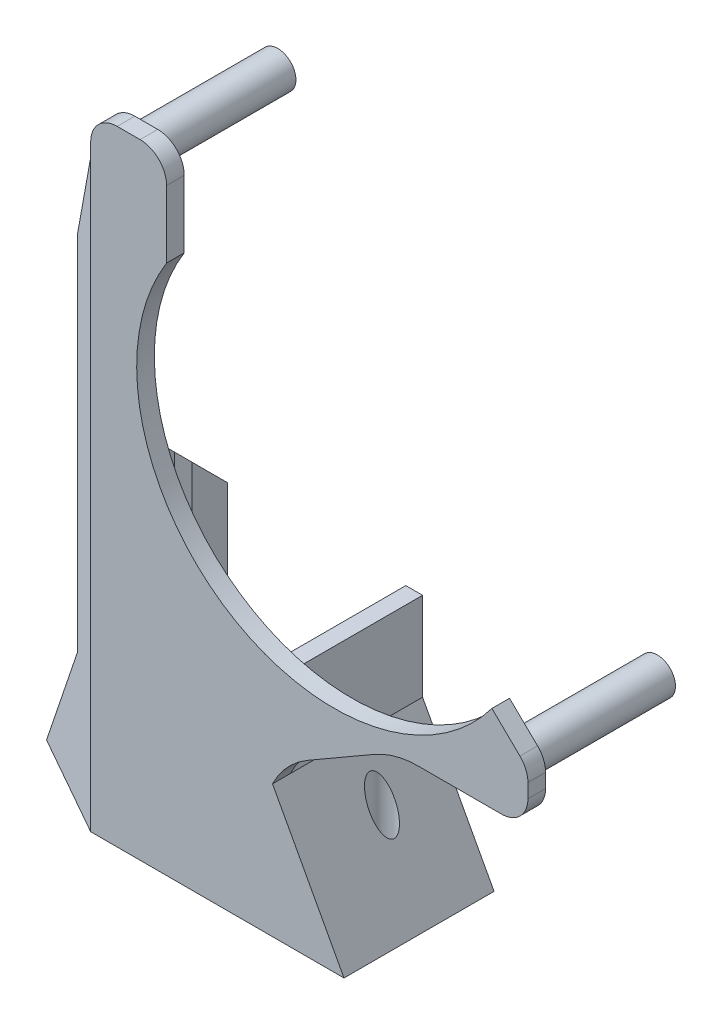
from build123d import *

# Parameters (mm, degrees)
SKETCH1_W               = 24
SKETCH1_H               = 25
BOSS_EXTRUDE1_DEPTH     = 17
SKETCH2_W               = 20.2
SKETCH2_H               = 15
CUT_EXTRUDE1_DEPTH      = 33.526911935
BOSS_EXTRUDE2_DEPTH     = 17
SKETCH5_R               = 1.4
CUT_EXTRUDE5_DEPTH      = 37.304407446
BOSS_EXTRUDE3_DEPTH     = 2
CUT_EXTRUDE4_DEPTH      = 74.16252394
CUT_EXTRUDE4_DEPTH_BACK = 74.16252394
SKETCH7_R               = 2.05
BOSS_EXTRUDE4_DEPTH     = 16
CHAMFER1_SIZE           = 1
CHAMFER2_SIZE           = 8
CHAMFER2_SIZE2          = 13.856406461
FILLET1_R               = 10
SKETCH8_W               = 1.9
SKETCH8_H               = 25
BOSS_EXTRUDE5_DEPTH     = 5
CHAMFER5_SIZE           = 5
CHAMFER6_SIZE           = 10
FILLET5_R               = 3
SKETCH9_W               = 5
SKETCH9_H               = 20.312892552
CUT_EXTRUDE6_DEPTH      = 1
CHAMFER7_SIZE           = 1


# Some blends are built 0.0001 mm under size
with BuildPart() as part:
    # Sketch1 → Boss-Extrude1 (new body)
    with BuildSketch(Plane.XY):
        Rectangle(SKETCH1_W, SKETCH1_H)
    extrude(amount=BOSS_EXTRUDE1_DEPTH)

    # Sketch2 → Cut-Extrude1 (cut, through all)
    with BuildSketch(Plane(origin=(0, 12.5, 0), x_dir=(1, 0, 0), z_dir=(0, 1, 0))):
        with Locations((0, -7.5)):
            Rectangle(SKETCH2_W, SKETCH2_H)
    extrude(amount=-CUT_EXTRUDE1_DEPTH, mode=Mode.SUBTRACT)

    # Sketch3 → Boss-Extrude2 (add)
    with BuildSketch(Plane.XY.offset(17)):
        Polygon((-12, -12.5), (-20.1, -12.5), (-12, 2.5), align=None)
        Polygon((12, -12.5), (20.1, -12.5), (12, 2.5), align=None)
    extrude(amount=-BOSS_EXTRUDE2_DEPTH)

    # Sketch5 → Cut-Extrude5 (cut, through all)
    with BuildSketch(Plane.XZ.offset(12.5)):
        with Locations(Location((-14.9, 7.5, 0), (0, 0, 270))):
            Circle(SKETCH5_R)
        with Locations(Location((14.9, 7.5, 0), (0, 0, 270))):
            Circle(SKETCH5_R)
    extrude(amount=-CUT_EXTRUDE5_DEPTH, mode=Mode.SUBTRACT)

    # Sketch6 → Boss-Extrude3 (add)
    with BuildSketch(Plane.XY.offset(17)):
        with BuildLine():
            Line((12, 12.5), (40.935171065, 12.5))
            Line((40.935171065, 12.5), (40.935171065, 18.357473763))
            Line((40.935171065, 18.357473763), (36.855912663, 22.32654969))
            ThreePointArc((36.855912663, 22.32654969), (6.329925709, 17.315872383), (0, 47.595813056))
            Line((0, 47.595813056), (0, 58.207101621))
            Line((0, 58.207101621), (-8.6, 58.207101621))
            Line((-8.6, 58.207101621), (-8.6, 53.667646312))
            Line((-8.6, 53.667646312), (-12, 43.559109862))
            Line((-12, 43.559109862), (-12, 12.5))
            Line((-12, 12.5), (12, 12.5))
        make_face()
    extrude(amount=-BOSS_EXTRUDE3_DEPTH)

    # Sketch4 → Cut-Extrude4 (cut, two sides: drawn at the far end of the back side and taken through both)
    with BuildSketch(Plane(origin=(0, 0, 0), x_dir=(1, 0, 0), z_dir=(0, 1, 0)).offset(-CUT_EXTRUDE4_DEPTH_BACK)):
        Polygon((-8.6, -17), (-20.1, -17), (-20.1, -10.5), align=None)
    extrude(amount=CUT_EXTRUDE4_DEPTH + CUT_EXTRUDE4_DEPTH_BACK, mode=Mode.SUBTRACT)

    # Sketch7 → Boss-Extrude4 (add)
    with BuildSketch(Plane(origin=(0, 0, 15), x_dir=(-1, 0, 0), z_dir=(0, 0, -1))):
        with Locations(Location((-37.6, 16.9, 0), (0, 0, 180))):
            Circle(SKETCH7_R)
        with Locations(Location((5.4, 54.9, 0), (0, 0, 180))):
            Circle(SKETCH7_R)
    extrude(amount=BOSS_EXTRUDE4_DEPTH)

    # Chamfer1
    chamfer1_edges = [part.edges().sort_by_distance(p)[0] for p in [
        (-14.9, -12.5, 8.9),
        (14.9, -12.5, 8.9),
    ]]
    chamfer(chamfer1_edges, length=CHAMFER1_SIZE)

    # Chamfer2
    chamfer2_edges = [part.edges().sort_by_distance(p)[0] for p in [
        (12, 12.5, 16),
    ]]
    chamfer2_side = [part.faces().sort_by_distance(p)[0] for p in [
        (12, 7.5, 8.5),
    ]]
    chamfer(chamfer2_edges, length=CHAMFER2_SIZE, length2=CHAMFER2_SIZE2, reference=chamfer2_side[0])

    # Fillet1
    # the kernel refuses this fillet: 10 mm, written as the material it adds along each edge
    with BuildSketch(Plane(origin=(12, 4.5, 15), x_dir=(0.8660254037844397, 0.4999999999999979, 0), z_dir=(0, 0, 1))) as fillet1_piece_1:
        with BuildLine():
            CenterArc((4.625034769, -10), FILLET1_R, 90, 34.229107271)
            Line((-1, -1.732050808), (-1.112500695, -1.566691824))
            ThreePointArc((-1.112500695, -1.566691824), (-0.673205081, -0.766025404), (-0.173205081, 0.1))
            Line((-0.173205081, 0.1), (0, 0.2))
            Line((0, 0.2), (4.625034769, 0.2))
            Line((4.625034769, 0.2), (4.625034769, 0))
        make_face()
    extrude(amount=2)
    with BuildSketch(Plane(origin=(25.856406461, 12.5, 15), x_dir=(1, 0, 0), z_dir=(0, 0, 1))) as fillet1_piece_2:
        with BuildLine():
            CenterArc((FILLET1_R * 0.267949192431, -FILLET1_R), FILLET1_R, 90, 30)
            Line((-FILLET1_R * 0.232050807569, -FILLET1_R * 0.133974596216), (-FILLET1_R * 0.242050807569, -FILLET1_R * 0.11665408814))
            Line((-FILLET1_R * 0.242050807569, -FILLET1_R * 0.11665408814), (-FILLET1_R * 0.00535898384862, FILLET1_R * 0.02))
            Line((-FILLET1_R * 0.00535898384862, FILLET1_R * 0.02), (FILLET1_R * 0.267949192431, FILLET1_R * 0.02))
            Line((FILLET1_R * 0.267949192431, FILLET1_R * 0.02), (FILLET1_R * 0.267949192431, 0))
        make_face()
    extrude(amount=2)

    # Sketch8 → Boss-Extrude5 (add)
    with BuildSketch(Plane(origin=(0, 0, 15), x_dir=(-1, 0, 0), z_dir=(0, 0, -1))):
        with Locations((11.05, 25)):
            Rectangle(SKETCH8_W, SKETCH8_H)
    extrude(amount=BOSS_EXTRUDE5_DEPTH)

    # Chamfer5
    chamfer5_edges = [part.edges().sort_by_distance(p)[0] for p in [
        (-11.05, 37.5, 15),
    ]]
    chamfer(chamfer5_edges, length=CHAMFER5_SIZE - 0.0001)  # a hair under: the kernel refuses the full size

    # Chamfer6
    chamfer6_edges = [part.edges().sort_by_distance(p)[0] for p in [
        (-11.05, 12.5, 10),
    ]]
    chamfer(chamfer6_edges, length=CHAMFER6_SIZE - 0.0001)  # a hair under: the kernel refuses the full size

    # Fillet5
    fillet5_edges = [part.edges().sort_by_distance(p)[0] for p in [
        (40.935171065, 18.357473763, 16),
        (40.935171065, 12.5, 16),
        (-8.6, 58.207101621, 16),
        (0, 58.207101621, 16),
    ]]
    fillet(fillet5_edges, radius=FILLET5_R)

    # Sketch9 → Cut-Extrude6 (cut)
    with BuildSketch(Plane(origin=(-10.1, 0, 0), x_dir=(0, 0, -1), z_dir=(1, 0, 0))):
        with Locations((-7.5, 14.513989876)):
            Rectangle(SKETCH9_W, SKETCH9_H)
    extrude(amount=-CUT_EXTRUDE6_DEPTH, mode=Mode.SUBTRACT)

    # Chamfer7
    chamfer7_edges = [part.edges().sort_by_distance(p)[0] for p in [
        (-10.1, 10.9287218, 5),
        (-10.1, 4.3575436, 7.5),
        (-10.1, 20.9287718, 10),
    ]]
    chamfer(chamfer7_edges, length=CHAMFER7_SIZE - 0.0001)  # a hair under: the kernel refuses the full size


solid = part.part
